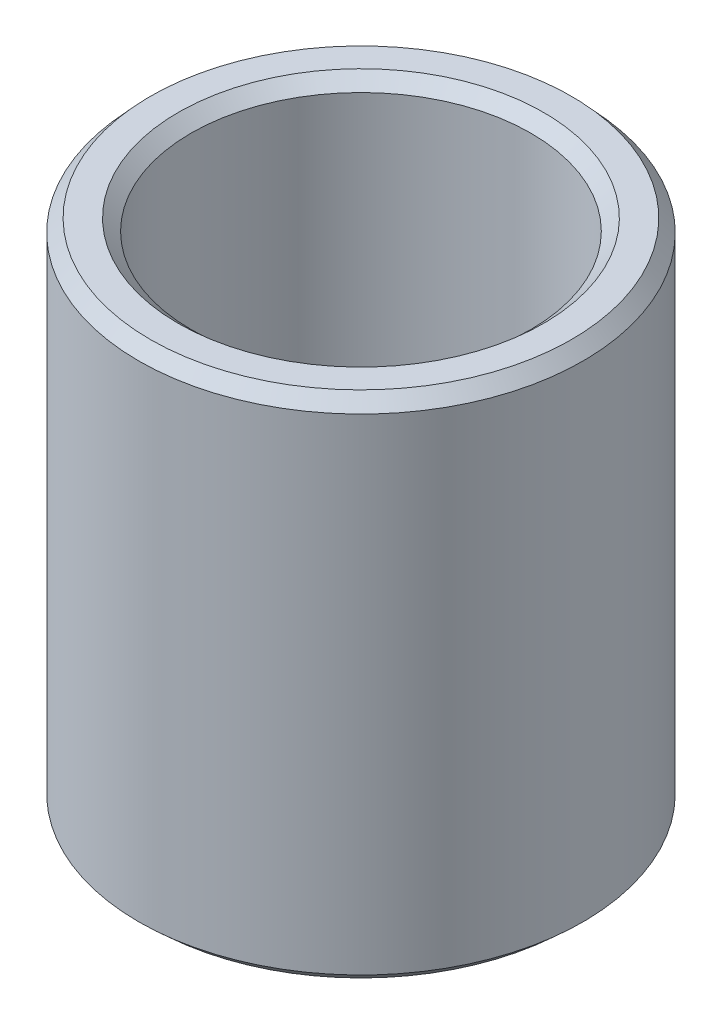
from build123d import *
from OCP.BRepFilletAPI import BRepFilletAPI_MakeChamfer

# Parameters (mm, degrees)
SKETCH1_R           = 60
BOSS_EXTRUDE1_DEPTH = 137.723440901
SKETCH2_R           = 45.89374581
CUT_EXTRUDE1_DEPTH  = 162.764477478
CHAMFER1_SIZE       = 3.443046649
CHAMFER1_SIZE2      = 3.13205477


with BuildPart() as part:
    # Sketch1 → Boss-Extrude1 (new body)
    with BuildSketch(Plane(origin=(0, 0, 0), x_dir=(1, 0, 0), z_dir=(0, 1, 0))):
        Circle(SKETCH1_R)
    extrude(amount=BOSS_EXTRUDE1_DEPTH)

    # Sketch2 → Cut-Extrude1 (cut, through all)
    with BuildSketch(Plane(origin=(0, 0, 0), x_dir=(1, 0, 0), z_dir=(0, 1, 0))):
        Circle(SKETCH2_R)
    extrude(amount=CUT_EXTRUDE1_DEPTH, mode=Mode.SUBTRACT)

    # Chamfer1: one chamfer whose edges measure the first distance from different faces: ONE call of the kernel's chamfer builder (chamfer() names one face for all edges)
    chamfer1_edges_1 = [part.edges().sort_by_distance(p)[0] for p in [
        (-45.89374581, 137.723440901, 0),
    ]]
    chamfer1_side_1 = [part.faces().sort_by_distance(p)[0] for p in [
        (-58.302943725, 137.723440901, 0),
    ]]
    chamfer1_edges_2 = [part.edges().sort_by_distance(p)[0] for p in [
        (-45.89374581, 0, 0),
    ]]
    chamfer1_side_2 = [part.faces().sort_by_distance(p)[0] for p in [
        (-45.89374581, 68.861720451, 0),
    ]]
    chamfer1_edges_3 = [part.edges().sort_by_distance(p)[0] for p in [
        (-60, 0, 0),
    ]]
    chamfer1_side_3 = [part.faces().sort_by_distance(p)[0] for p in [
        (-58.302943725, 0, 0),
    ]]
    chamfer1_edges_4 = [part.edges().sort_by_distance(p)[0] for p in [
        (-60, 137.723440901, 0),
    ]]
    chamfer1_side_4 = [part.faces().sort_by_distance(p)[0] for p in [
        (-60, 68.861720451, 0),
    ]]
    chamfer1 = BRepFilletAPI_MakeChamfer(part.part.solid().wrapped)
    for e in chamfer1_edges_1:
        chamfer1.Add(CHAMFER1_SIZE, CHAMFER1_SIZE2, e.wrapped, chamfer1_side_1[0].wrapped)  # the first distance lies on this face
    for e in chamfer1_edges_2:
        chamfer1.Add(CHAMFER1_SIZE, CHAMFER1_SIZE2, e.wrapped, chamfer1_side_2[0].wrapped)  # the first distance lies on this face
    for e in chamfer1_edges_3:
        chamfer1.Add(CHAMFER1_SIZE, CHAMFER1_SIZE2, e.wrapped, chamfer1_side_3[0].wrapped)  # the first distance lies on this face
    for e in chamfer1_edges_4:
        chamfer1.Add(CHAMFER1_SIZE, CHAMFER1_SIZE2, e.wrapped, chamfer1_side_4[0].wrapped)  # the first distance lies on this face
    add(Compound.cast(chamfer1.Shape()), mode=Mode.REPLACE)


solid = part.part
